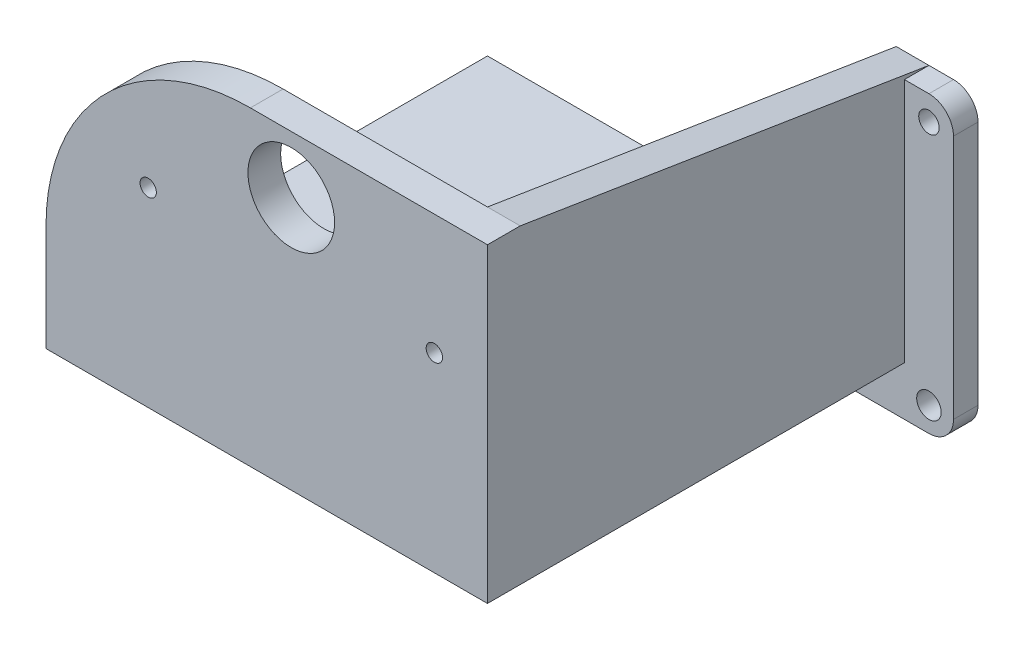
from build123d import *

# Parameters (mm, degrees)
ESBO_O1_W                = 54
ESBO_O1_H                = 38
RESSALTO_EXTRUS_O1_DEPTH = 4
RESSALTO_EXTRUS_O2_DEPTH = 50
CORTE_EXTRUS_O3_REACH    = 78.007
RESSALTO_EXTRUS_O3_DEPTH = 3
FILETE1_R                = 3
ESBO_O4_R                = 1.5
ESBO_O4_R_2              = 1.25
CORTE_EXTRUS_O1_DEPTH    = 66.6886596
ESBO_O5_R                = 1
ESBO_O5_R_2              = 5.3
CORTE_EXTRUS_O2_DEPTH    = 69.044103345
FILETE2_R                = 25
ESBO_O7_R                = 1.25
CORTE_EXTRUS_O4_DEPTH    = 71.943639602


with BuildPart() as part:
    # Esboço1 → Ressalto-extrusão1 (new body)
    with BuildSketch(Plane.XY):
        Rectangle(ESBO_O1_W, ESBO_O1_H)
    extrude(amount=RESSALTO_EXTRUS_O1_DEPTH)

    # Esboço2 → Ressalto-extrusão2 (add)
    with BuildSketch(Plane(origin=(0, 0, 0), x_dir=(-1, 0, 0), z_dir=(0, 0, -1))):
        Polygon((-27, 19), (-23, 19), (-23, -15), (27, -15), (27, -19), (-27, -19), align=None)
    extrude(amount=RESSALTO_EXTRUS_O2_DEPTH)

    # Esboço6 → Corte-extrusão3 (cut, up to next)
    with BuildSketch(Plane(origin=(27, 0, 0), x_dir=(0, 0, -1), z_dir=(1, 0, 0)), mode=Mode.PRIVATE) as corte_extrus_o3_sk1:
        Polygon((0, 19), (50, 11), (50, 19), align=None)
    corte_extrus_o3_tool1 = extrude(corte_extrus_o3_sk1.sketch, amount=-CORTE_EXTRUS_O3_REACH, mode=Mode.PRIVATE) & part.part
    add(corte_extrus_o3_tool1.solids().sort_by_distance((27, 16.333333, -33.333333))[0], mode=Mode.SUBTRACT)

    # Esboço3 → Ressalto-extrusão3 (add)
    with BuildSketch(Plane(origin=(0, 0, -50), x_dir=(-1, 0, 0), z_dir=(0, 0, -1))):
        Polygon((-27, 11), (-33, 11), (-33, -25), (27, -25), (27, -19), (-27, -19), align=None)
    extrude(amount=-RESSALTO_EXTRUS_O3_DEPTH)

    # Filete1
    filete1_edges = [part.edges().sort_by_distance(p)[0] for p in [
        (33, -25, -48.5),
        (-27, -25, -48.5),
        (33, 11, -48.5),
    ]]
    fillet(filete1_edges, radius=FILETE1_R)

    # Esboço4 → Corte-extrusão1 (cut, through all)
    with BuildSketch(Plane.XY.offset(-47)):
        with Locations((-24, -22)):
            Circle(ESBO_O4_R)
        with Locations((30, -22)):
            Circle(ESBO_O4_R)
        with Locations((30, 8)):
            Circle(ESBO_O4_R_2)
    extrude(amount=-CORTE_EXTRUS_O1_DEPTH, mode=Mode.SUBTRACT)

    # Esboço5 → Corte-extrusão2 (cut, through all)
    with BuildSketch(Plane.XY.offset(4)):
        with Locations((-14.5, 4.3)):
            Circle(ESBO_O5_R)
        with Locations((20.5, 4.3)):
            Circle(ESBO_O5_R)
        with Locations((3, 12)):
            Circle(ESBO_O5_R_2)
    extrude(amount=-CORTE_EXTRUS_O2_DEPTH, mode=Mode.SUBTRACT)

    # Filete2
    filete2_edges = [part.edges().sort_by_distance(p)[0] for p in [
        (-27, 19, 2),
    ]]
    fillet(filete2_edges, radius=FILETE2_R)

    # Esboço7 → Corte-extrusão4 (cut, through all)
    with BuildSketch(Plane.XZ.offset(19)):
        with Locations((3, -14.3)):
            Circle(ESBO_O7_R)
        with Locations((3, -22.3)):
            Circle(ESBO_O7_R)
    extrude(amount=-CORTE_EXTRUS_O4_DEPTH, mode=Mode.SUBTRACT)


solid = part.part
